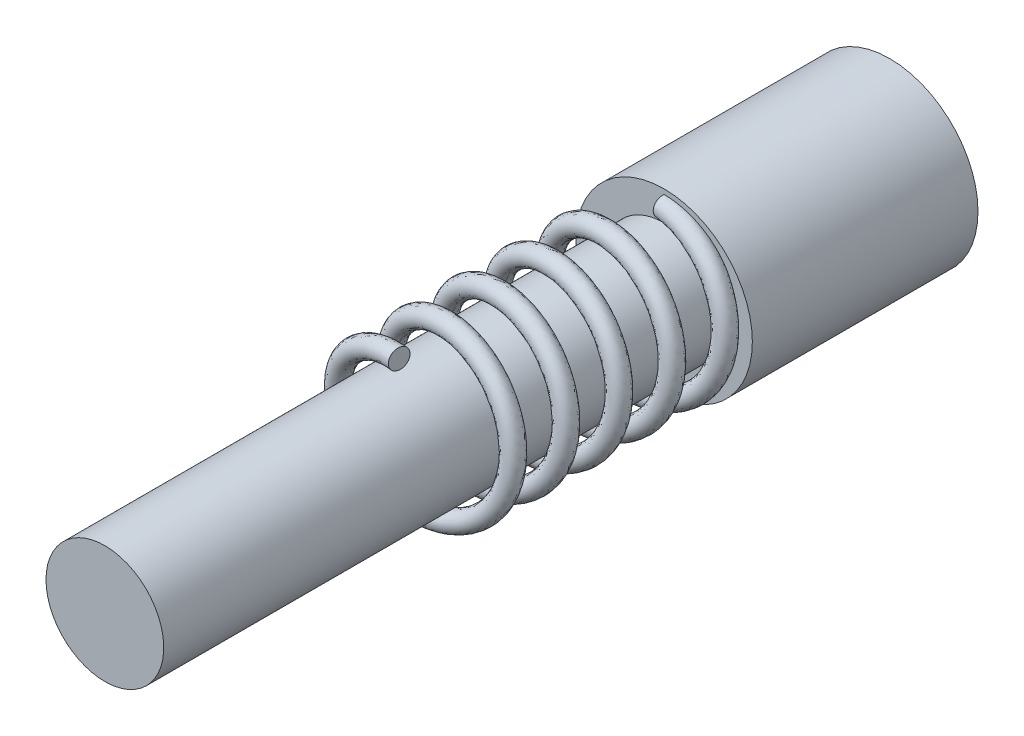
from build123d import *

# Parameters (mm, degrees)
SKETCH1_R           = 4.5
BOSS_EXTRUDE2_DEPTH = 11.5
SKETCH16_R          = 3
BOSS_EXTRUDE3_DEPTH = 28.5
SWEEP2_PITCH        = 2.7


with BuildPart() as part:
    # Sketch1 → Boss-Extrude2 (new body)
    with BuildSketch(Plane.XY):
        Circle(SKETCH1_R)
    extrude(amount=BOSS_EXTRUDE2_DEPTH)

    # Sketch16 → Boss-Extrude3 (add)
    with BuildSketch(Plane.XY.offset(11.5)):
        with Locations(Location((0, 0, 0), (0, 0, 180))):
            Circle(SKETCH16_R)
    extrude(amount=BOSS_EXTRUDE3_DEPTH)

    # Sweep2: the profile of Sweep2 profile screwed along a left-hand helix of 5 turns, 10 arcs to a turn; built about Z, then put on its axis
    sweep2_z = Axis((0, 0, 0), (0, 0, 1))
    sweep2_corners = [(3.75, 0.056923262, 0.496749174), (3.25, 0, 0), (3.75, -0.056923262, -0.496749174), (4.25, 0, 0)]
    with BuildLine(mode=Mode.PRIVATE) as sweep2_profile:
        ThreePointArc((3.75, 0.056923262, 0.496749174), (3.396446609, 0.040250825, 0.35125471), (3.25, 0, 0))
        ThreePointArc((3.25, 0, 0), (3.396446609, -0.040250825, -0.35125471), (3.75, -0.056923262, -0.496749174))
        ThreePointArc((3.75, -0.056923262, -0.496749174), (4.103553391, -0.040250825, -0.35125471), (4.25, 0, 0))
        ThreePointArc((4.25, 0, 0), (4.103553391, 0.040250825, 0.35125471), (3.75, 0.056923262, 0.496749174))
    sweep2_cap = Face(sweep2_profile.wire())
    sweep2_arcs = [((3.75, 0.056923262, 0.496749174), (3.25, 0.056923262, 0.496749174), (3.25, 0, 0), (1, 0.7071067811865476, 1)), ((3.25, 0, 0), (3.25, -0.056923262, -0.496749174), (3.75, -0.056923262, -0.496749174), (1, 0.7071067811865476, 1)), ((3.75, -0.056923262, -0.496749174), (4.25, -0.056923262, -0.496749174), (4.25, 0, 0), (1, 0.7071067811865476, 1)), ((4.25, 0, 0), (4.25, 0.056923262, 0.496749174), (3.75, 0.056923262, 0.496749174), (1, 0.7071067811865476, 1))]  # start, shoulder, end, weights
    sweep2_turn_angles = [0, -18, -36, -54, -72, -90, -108, -126, -144, -162, -180, -198, -216, -234, -252, -270, -288, -306, -324, -342, -360]
    sweep2_turn_weights = [1, 0.9510565162951535, 1, 0.9510565162951535, 1, 0.9510565162951535, 1, 0.9510565162951535, 1, 0.9510565162951535, 1, 0.9510565162951535, 1, 0.9510565162951535, 1, 0.9510565162951535, 1, 0.9510565162951535, 1, 0.9510565162951535, 1]
    sweep2_turn_sides = [Face.make_bezier_surface([[Vector(p[j][0], p[j][1], 0).rotate(sweep2_z, sweep2_turn_angles[2 * i + k]) / sweep2_turn_weights[2 * i + k] + Vector(0, 0, p[j][2] + -SWEEP2_PITCH * sweep2_turn_angles[2 * i + k] / 360) for k in range(3)] for j in range(3)], [[p[3][j] * sweep2_turn_weights[2 * i + k] for k in range(3)] for j in range(3)]) for p in sweep2_arcs for i in range(10)]
    sweep2 = Plane(origin=(0, 0, 11.5), x_dir=(0, 1, 0), z_dir=(0, 0, 1)) * Solid(Shell([*[p.moved(Location((0, 0, SWEEP2_PITCH * i))) for i in range(5) for p in sweep2_turn_sides], sweep2_cap, sweep2_cap.rotate(sweep2_z, -1800).moved(Location((0, 0, -SWEEP2_PITCH * -1800 / 360)))]))
    add(sweep2)


solid = part.part
